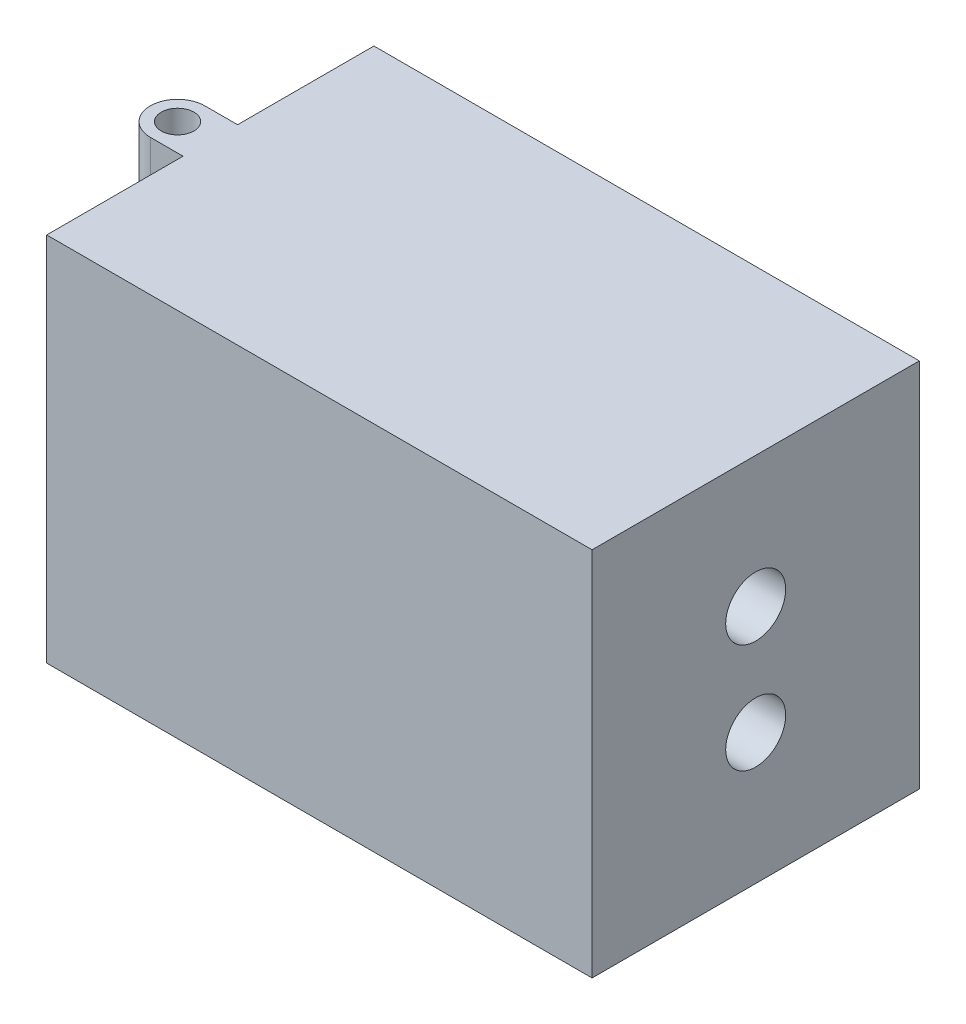
from build123d import *

# Parameters (mm, degrees)
ESQUISSE1_W             = 50
ESQUISSE1_H             = 34
BOSS_EXTRU_1_DEPTH      = 30
ESQUISSE10_R            = 1.5
BOSS_EXTRU_3_DEPTH      = 5
ENL_V_MAT_EXTRU_6_DEPTH = 45
ESQUISSE12_R            = 2.75
ENL_V_MAT_EXTRU_7_DEPTH = 68.498148123


with BuildPart() as part:
    # Esquisse1 → Boss.-Extru.1 (new body)
    with BuildSketch(Plane.XY):
        with Locations((25, 17)):
            Rectangle(ESQUISSE1_W, ESQUISSE1_H)
    extrude(amount=BOSS_EXTRU_1_DEPTH)

    # Esquisse10 → Boss.-Extru.3 (add)
    with BuildSketch(Plane(origin=(0, 34, 0), x_dir=(1, 0, 0), z_dir=(0, 1, 0))):
        with BuildLine():
            Line((0, -12.5), (0, -17.5))
            Line((0, -17.5), (-3, -17.5))
            ThreePointArc((-3, -17.5), (-5.5, -15), (-3, -12.5))
            Line((-3, -12.5), (0, -12.5))
        make_face()
        with Locations((-3, -15)):
            Circle(ESQUISSE10_R, mode=Mode.SUBTRACT)
    boss_extru_3 = extrude(amount=-BOSS_EXTRU_3_DEPTH)

    # Symétrie2: Boss.-Extru.3 across plane
    add(boss_extru_3.mirror(Plane.ZX.offset(17)))

    # Esquisse11 → Enlèv. mat.-Extru.6 (cut)
    with BuildSketch(Plane.ZY):
        Polygon((10.381197846, 12), (12.690598923, 8), (17.309401077, 8), (19.618802154, 12), (17.309401077, 16), (12.690598923, 16), align=None)
        Polygon((10.381197846, 22), (12.690598923, 18), (17.309401077, 18), (19.618802154, 22), (17.309401077, 26), (12.690598923, 26), align=None)
    extrude(amount=-ENL_V_MAT_EXTRU_6_DEPTH, mode=Mode.SUBTRACT)

    # Esquisse12 → Enlèv. mat.-Extru.7 (cut, through all)
    with BuildSketch(Plane.ZY):
        with Locations((15, 12)):
            Circle(ESQUISSE12_R)
        with Locations((15, 22)):
            Circle(ESQUISSE12_R)
    extrude(amount=-ENL_V_MAT_EXTRU_7_DEPTH, mode=Mode.SUBTRACT)


solid = part.part
